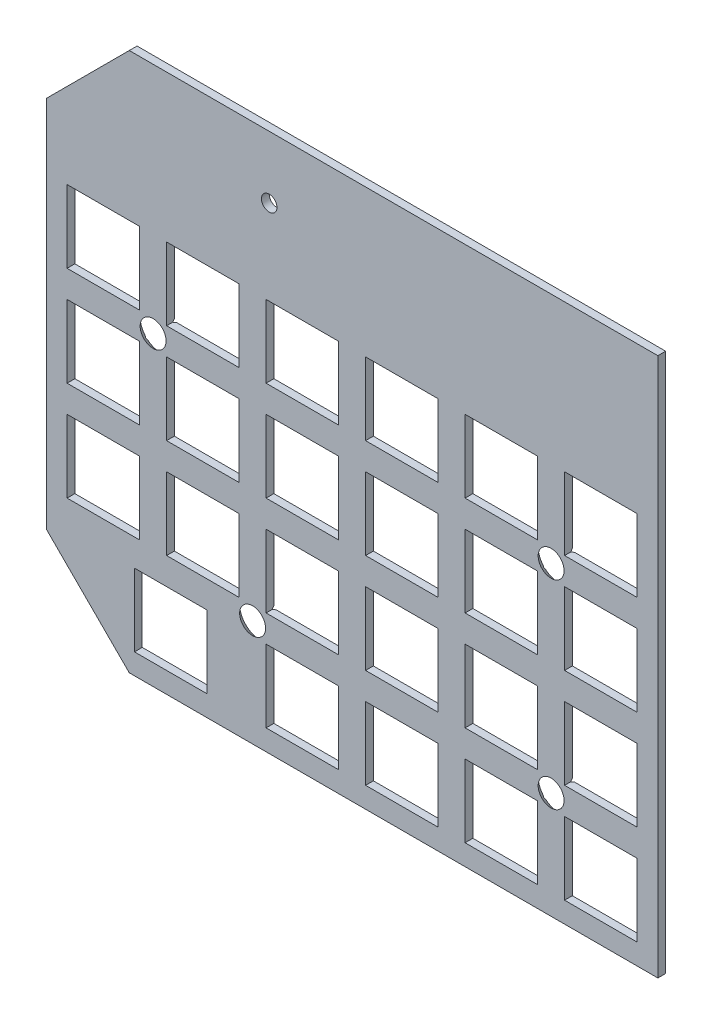
from build123d import *

# Parameters (mm, degrees)
BOSS_EXTRU_1_DEPTH                          = 1.5
ESQUISSE3_R                                 = 1.5
ESQUISSE3_W                                 = 14
ESQUISSE3_H                                 = 14
ENL_V_MAT_EXTRU_2_DEPTH                     = 10
FRAISAGE_POUR_VIS_T_TE_FRAIS_E_M41_AT_COUNT = 2
FRAISAGE_POUR_VIS_T_TE_FRAIS_E_M41_AT_PITCH = 38.4
FRAISAGE_POUR_VIS_T_TE_FRAIS_E_M41_2_COUNT  = 2
FRAISAGE_POUR_VIS_T_TE_FRAIS_E_M41_2_PITCH  = 76.8
FRAISAGE_POUR_VIS_T_TE_FRAIS_E_M41_3_COUNT  = 2
FRAISAGE_POUR_VIS_T_TE_FRAIS_E_M41_3_PITCH  = 69.226584489


with BuildPart() as part:
    # Esquisse1 → Boss.-Extru.1 (new body)
    with BuildSketch(Plane.XY):
        Polygon((0, -85), (16, -101), (118, -101), (118, 3), (16, 3), (0, -13), align=None)
    extrude(amount=BOSS_EXTRU_1_DEPTH)

    # Esquisse3 → Enlèv. mat.-Extru.2 (cut)
    with BuildSketch(Plane(origin=(0, 0, 0), x_dir=(-1, 0, 0), z_dir=(0, 0, -1))):
        with Locations((-43, -9)):
            Circle(ESQUISSE3_R)
        with Locations((-87.8, -32.4)):
            Rectangle(ESQUISSE3_W, ESQUISSE3_H)
        with Locations((-107, -32.4)):
            Rectangle(ESQUISSE3_W, ESQUISSE3_H)
        with Locations((-68.6, -32.4)):
            Rectangle(ESQUISSE3_W, ESQUISSE3_H)
        with Locations((-49.4, -32.4)):
            Rectangle(ESQUISSE3_W, ESQUISSE3_H)
        with Locations((-30.2, -32.4)):
            Rectangle(ESQUISSE3_W, ESQUISSE3_H)
        with Locations((-11, -32.4)):
            Rectangle(ESQUISSE3_W, ESQUISSE3_H)
        with Locations((-87.8, -51.6)):
            Rectangle(ESQUISSE3_W, ESQUISSE3_H)
        with Locations((-68.6, -51.6)):
            Rectangle(ESQUISSE3_W, ESQUISSE3_H)
        with Locations((-49.4, -51.6)):
            Rectangle(ESQUISSE3_W, ESQUISSE3_H)
        with Locations((-30.2, -51.6)):
            Rectangle(ESQUISSE3_W, ESQUISSE3_H)
        with Locations((-11, -51.6)):
            Rectangle(ESQUISSE3_W, ESQUISSE3_H)
        with Locations((-87.8, -70.8)):
            Rectangle(ESQUISSE3_W, ESQUISSE3_H)
        with Locations((-68.6, -70.8)):
            Rectangle(ESQUISSE3_W, ESQUISSE3_H)
        with Locations((-49.4, -70.8)):
            Rectangle(ESQUISSE3_W, ESQUISSE3_H)
        with Locations((-30.2, -70.8)):
            Rectangle(ESQUISSE3_W, ESQUISSE3_H)
        with Locations((-11, -70.8)):
            Rectangle(ESQUISSE3_W, ESQUISSE3_H)
        with Locations((-87.8, -90)):
            Rectangle(ESQUISSE3_W, ESQUISSE3_H)
        with Locations((-68.6, -90)):
            Rectangle(ESQUISSE3_W, ESQUISSE3_H)
        with Locations((-49.4, -90)):
            Rectangle(ESQUISSE3_W, ESQUISSE3_H)
        with Locations((-107, -51.6)):
            Rectangle(ESQUISSE3_W, ESQUISSE3_H)
        with Locations((-107, -70.8)):
            Rectangle(ESQUISSE3_W, ESQUISSE3_H)
        with Locations((-107, -90)):
            Rectangle(ESQUISSE3_W, ESQUISSE3_H)
        with Locations((-24, -90)):
            Rectangle(ESQUISSE3_W, ESQUISSE3_H)
    extrude(amount=-ENL_V_MAT_EXTRU_2_DEPTH, mode=Mode.SUBTRACT)

    # Esquisse6 → Fraisage pour vis à tête fraisée M41 (revolve, cut)
    with BuildSketch(Plane(origin=(97.4, -42, 0), x_dir=(0, 1, 0), z_dir=(1, 0, 0))):
        Polygon((0, 0), (0, 1.5), (2.25, 1.5), (2.25, 1.75), (4, 0), align=None)
    fraisage_pour_vis_t_te_frais_e_m41 = revolve(axis=Axis((97.4, -42, -6.35), (0, 0, 1)), mode=Mode.SUBTRACT)

    # Fraisage pour vis à tête fraisée M41 at: Fraisage pour vis à tête fraisée M41 ×2
    with Locations(*[(0, -i * FRAISAGE_POUR_VIS_T_TE_FRAIS_E_M41_AT_PITCH, 0) for i in range(1, FRAISAGE_POUR_VIS_T_TE_FRAIS_E_M41_AT_COUNT)]):
        add(fraisage_pour_vis_t_te_frais_e_m41, mode=Mode.SUBTRACT)

    # Fraisage pour vis _ t_te frais_e M41 2: Fraisage pour vis à tête fraisée M41 ×2
    with Locations(*[(-i * FRAISAGE_POUR_VIS_T_TE_FRAIS_E_M41_2_PITCH, 0, 0) for i in range(1, FRAISAGE_POUR_VIS_T_TE_FRAIS_E_M41_2_COUNT)]):
        add(fraisage_pour_vis_t_te_frais_e_m41, mode=Mode.SUBTRACT)

    # Fraisage pour vis _ t_te frais_e M41 3: Fraisage pour vis à tête fraisée M41 ×2
    with Locations(*[Vector(-0.8320502943378439, -0.5547001962252288, 0) * (i * FRAISAGE_POUR_VIS_T_TE_FRAIS_E_M41_3_PITCH) for i in range(1, FRAISAGE_POUR_VIS_T_TE_FRAIS_E_M41_3_COUNT)]):
        add(fraisage_pour_vis_t_te_frais_e_m41, mode=Mode.SUBTRACT)


solid = part.part
